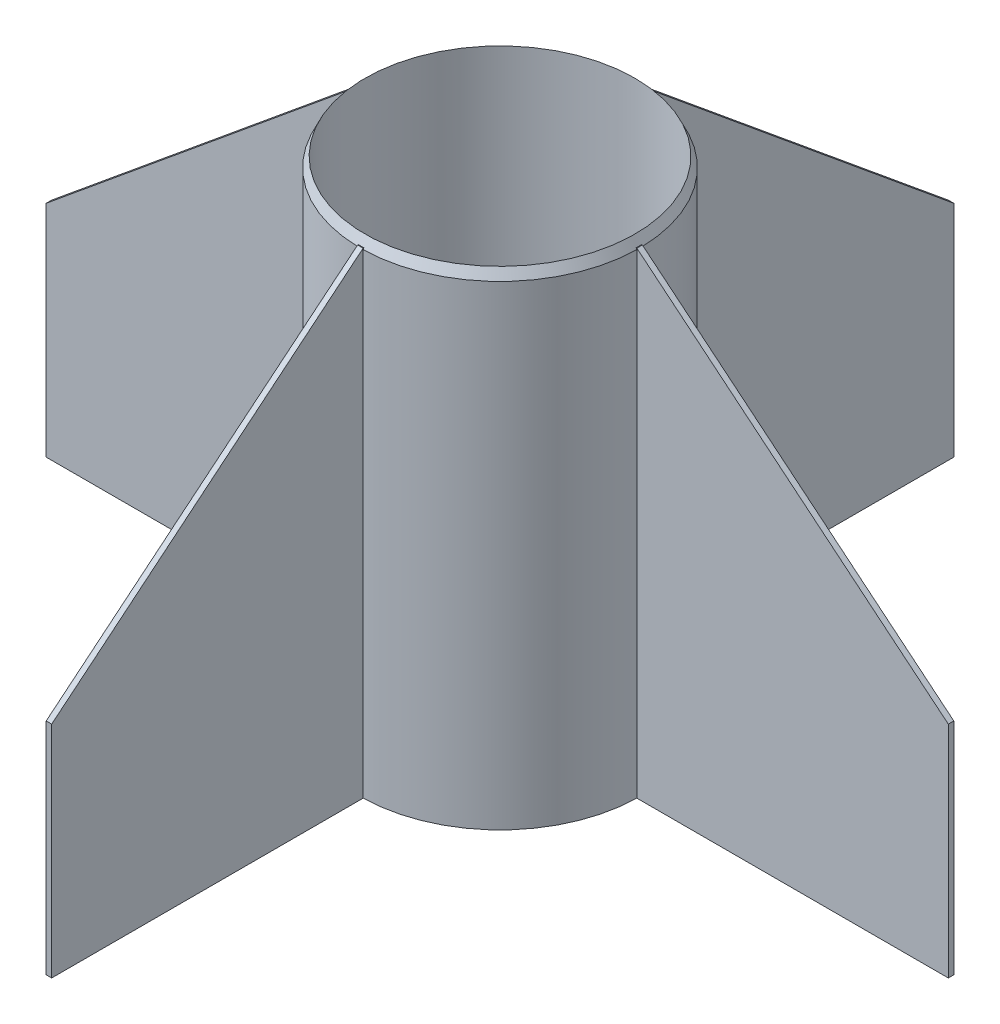
from build123d import *

# Parameters (mm, degrees)
SKETCH1_R                = 76.2
SKETCH1_R_2              = 73.7
BOSS_EXTRUDE1_DEPTH      = 260
BOSS_EXTRUDE2_DEPTH      = 1.5
BOSS_EXTRUDE2_DEPTH_BACK = 1.5
BOSS_EXTRUDE3_DEPTH      = 1.5
BOSS_EXTRUDE3_DEPTH_BACK = 1.5
SKETCH4_W                = 2
SKETCH4_H                = 260
CIRPATTERN1_COUNT        = 4
SKETCH6_R                = 73.7
BOSS_EXTRUDE4_DEPTH      = 10
CHAMFER1_START           = 264.638732699
CHAMFER1_2_OUTLINE_R     = 76.2
CHAMFER1_2_OUTLINE_R_2   = 73.7
CHAMFER1_2_DEPTH         = 5.361267301
CHAMFER1_START_2         = 258
CHAMFER1_3_DEPTH         = 2


with BuildPart() as part:
    # Sketch1 → Boss-Extrude1 (new body)
    with BuildSketch(Plane(origin=(0, 0, 0), x_dir=(1, 0, 0), z_dir=(0, 1, 0))):
        with Locations(Location((0, 0, 0), (0, 0, 270))):
            Circle(SKETCH1_R)
        with Locations(Location((0, 0, 0), (0, 0, 270))):
            Circle(SKETCH1_R_2, mode=Mode.SUBTRACT)
    extrude(amount=BOSS_EXTRUDE1_DEPTH)



with BuildPart() as body_2:
    # Sketch2 → Boss-Extrude2 (new, two sides: drawn at the far end of the back side and taken through both)
    with BuildSketch(Plane.XY.offset(-BOSS_EXTRUDE2_DEPTH_BACK)):
        Polygon((76.2, 0), (76.2, 260), (246.2, 120), (246.2, 0), align=None)
    extrude(amount=BOSS_EXTRUDE2_DEPTH + BOSS_EXTRUDE2_DEPTH_BACK)


with BuildPart() as part_1:
    add(part.part)

    add(body_2.part)  # Boss-Extrude3 merges body 2
    # Sketch4 → Boss-Extrude3 (add, two sides: drawn at the far end of the back side and taken through both)
    with BuildSketch(Plane.XY.offset(-BOSS_EXTRUDE3_DEPTH_BACK)):
        with Locations((75.2, 130)):
            Rectangle(SKETCH4_W, SKETCH4_H)
    extrude(amount=BOSS_EXTRUDE3_DEPTH + BOSS_EXTRUDE3_DEPTH_BACK)


with BuildPart() as cirpattern1_1:
    # CirPattern1: pattern copy
    add(part_1.part.rotate(Axis((0, 0, 0), (0, 1, 0)), 1 * 360 / CIRPATTERN1_COUNT))


with BuildPart() as cirpattern1_2:
    # CirPattern1: pattern copy
    add(part_1.part.rotate(Axis((0, 0, 0), (0, 1, 0)), 2 * 360 / CIRPATTERN1_COUNT))


with BuildPart() as cirpattern1_3:
    # CirPattern1: pattern copy
    add(part_1.part.rotate(Axis((0, 0, 0), (0, 1, 0)), 3 * 360 / CIRPATTERN1_COUNT))


with BuildPart() as part_2:
    add(part_1.part)

    add(cirpattern1_1.part)  # Boss-Extrude4 merges CirPattern1_1

    add(cirpattern1_2.part)  # Boss-Extrude4 merges CirPattern1_2

    add(cirpattern1_3.part)  # Boss-Extrude4 merges CirPattern1_3
    # Sketch6 → Boss-Extrude4 (add)
    with BuildSketch(Plane(origin=(0, 260, 0), x_dir=(1, 0, 0), z_dir=(0, 1, 0))):
        with BuildLine():
            ThreePointArc((76.18523479, -1.5), (76.2, 0), (76.18523479, 1.5))
            ThreePointArc((76.18523479, 1.5), (53.881536726, 53.881536726), (1.5, 76.18523479))
            ThreePointArc((1.5, 76.18523479), (0, 76.2), (-1.5, 76.18523479))
            ThreePointArc((-1.5, 76.18523479), (-53.881536726, -53.881536726), (76.18523479, -1.5))
        make_face()
        with Locations(Location((0, 0, 0), (0, 0, 270))):
            Circle(SKETCH6_R, mode=Mode.SUBTRACT)
    extrude(amount=BOSS_EXTRUDE4_DEPTH)

    # Chamfer1: read off the stored shape, not the designer's step
    # Chamfer1 outline → Chamfer1 (revolve, cut)
    with BuildSketch(Plane.XY):
        Polygon((73.7, 264.638732699), (76.2, 259.277465397), (76.2, 264.638732699), align=None)
    revolve(axis=Axis((0, 0, 0), (0, 1, 0)), mode=Mode.SUBTRACT)

    # Chamfer1 2 outline → Chamfer1 2 (cut)
    with BuildSketch(Plane(origin=(0, 0, 0), x_dir=(1, 0, 0), z_dir=(0, 1, 0)).offset(CHAMFER1_START)):
        Circle(CHAMFER1_2_OUTLINE_R)
        Circle(CHAMFER1_2_OUTLINE_R_2, mode=Mode.SUBTRACT)
    extrude(amount=CHAMFER1_2_DEPTH, mode=Mode.SUBTRACT)

    # Chamfer1 3 outline → Chamfer1 3 (add)
    with BuildSketch(Plane(origin=(0, 0, 0), x_dir=(1, 0, 0), z_dir=(0, 1, 0)).offset(CHAMFER1_START_2)):
        with BuildLine():
            ThreePointArc((76.18523479, -1.5), (76.2, 0), (76.18523479, 1.5))
            Line((76.18523479, 1.5), (75.848245783, 1.5))
            ThreePointArc((75.848245783, 1.5), (75.863076582, 0), (75.848245783, -1.5))
            Line((75.848245783, -1.5), (76.18523479, -1.5))
        make_face()
        with BuildLine():
            Line((1.5, 75.848245783), (1.5, 76.18523479))
            ThreePointArc((1.5, 76.18523479), (0, 76.2), (-1.5, 76.18523479))
            Line((-1.5, 76.18523479), (-1.5, 75.848245783))
            ThreePointArc((-1.5, 75.848245783), (0, 75.863076582), (1.5, 75.848245783))
        make_face()
        with BuildLine():
            ThreePointArc((-1.5, -76.18523479), (0, -76.2), (1.5, -76.18523479))
            Line((1.5, -76.18523479), (1.5, -75.848245783))
            ThreePointArc((1.5, -75.848245783), (0, -75.863076582), (-1.5, -75.848245783))
            Line((-1.5, -75.848245783), (-1.5, -76.18523479))
        make_face()
        with BuildLine():
            Line((-75.848245783, 1.5), (-76.18523479, 1.5))
            ThreePointArc((-76.18523479, 1.5), (-76.2, 0), (-76.18523479, -1.5))
            Line((-76.18523479, -1.5), (-75.848245783, -1.5))
            ThreePointArc((-75.848245783, -1.5), (-75.863076582, 0), (-75.848245783, 1.5))
        make_face()
    extrude(amount=CHAMFER1_3_DEPTH)


solid = part_2.part
